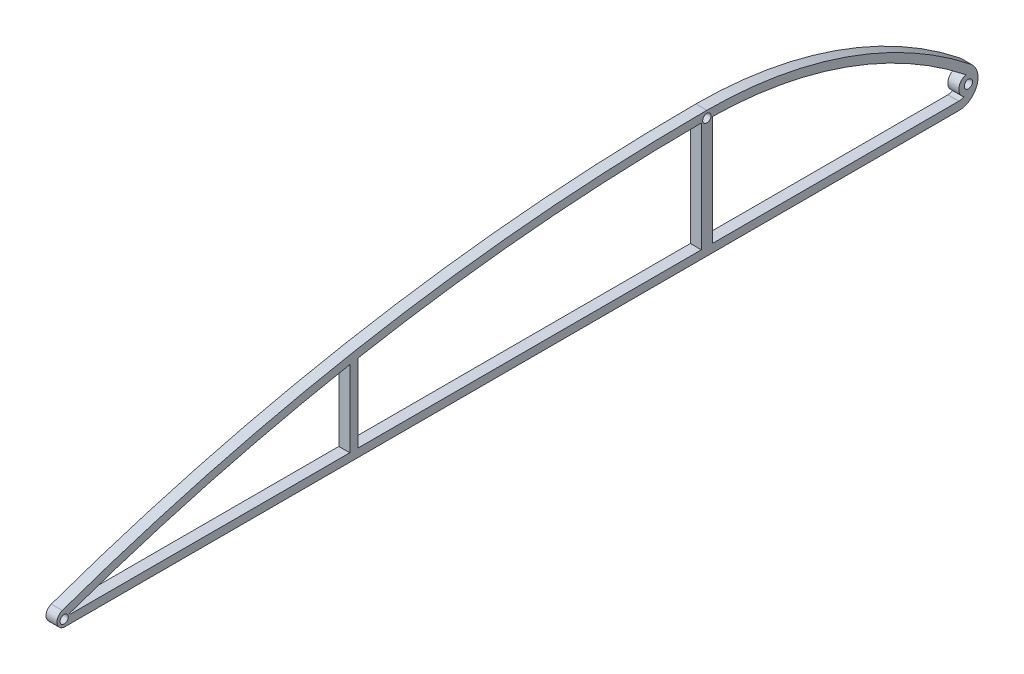
from build123d import *

# Parameters (mm, degrees)
BOSS_EXTRU_1_DEPTH      = 2
ESQUISSE4_R             = 0.75
ENL_V_MAT_EXTRU_2_DEPTH = 176.894862906
ENL_V_MAT_EXTRU_3_DEPTH = 4
CONG_2_R                = 1.45


with BuildPart() as part:
    # Esquisse2 → Boss.-Extru.1 (new body)
    with BuildSketch(Plane(origin=(0, 0, 0), x_dir=(0, 0, -1), z_dir=(1, 0, 0))):
        with BuildLine():
            Line((0, 0), (170.873171093, 0))
            ThreePointArc((170.873171093, 0), (174.177922559, 2.347343181), (173.049882129, 6.240789861))
            ThreePointArc((173.049882129, 6.240789861), (150.444362328, 18.689979585), (125, 23))
            ThreePointArc((125, 23), (61.450806457, 17.202138822), (0, 0))
        make_face()
    extrude(amount=BOSS_EXTRU_1_DEPTH)

    # Esquisse4 → Enlèv. mat.-Extru.2 (cut, through all)
    with BuildSketch(Plane(origin=(2, 0, 0), x_dir=(0, 0, -1), z_dir=(1, 0, 0))):
        with Locations((125, 21.75)):
            Circle(ESQUISSE4_R)
        with Locations((172.618958832, 3.328337296)):
            Circle(ESQUISSE4_R)
        with Locations((8, 1.25)):
            Circle(ESQUISSE4_R)
    extrude(amount=-ENL_V_MAT_EXTRU_2_DEPTH, mode=Mode.SUBTRACT)

    # Esquisse9 → Enlèv. mat.-Extru.3 (cut)
    with BuildSketch(Plane(origin=(0, 0, 0), x_dir=(0, 0, -1), z_dir=(1, 0, 0))):
        with BuildLine():
            Line((126, 1.5), (170.873171093, 1.5))
            ThreePointArc((170.873171093, 1.5), (171.378747106, 1.564956617), (171.851482612, 1.755607106))
            ThreePointArc((171.851482612, 1.755607106), (170.877358103, 3.499588293), (172.172511728, 5.020432147))
            ThreePointArc((172.172511728, 5.020432147), (172.144964437, 5.043548409), (172.11700597, 5.066165635))
            ThreePointArc((172.11700597, 5.066165635), (150.432293025, 17.103742315), (126.021977416, 21.493106696))
            ThreePointArc((126.021977416, 21.493106696), (126.011314857, 21.467285013), (126, 21.441742431))
            Line((126, 21.441742431), (126, 1.5))
        make_face()
        with BuildLine():
            Line((9.071214264, 1.5), (60, 1.5))
            Line((60, 1.5), (60, 15.405547145))
            ThreePointArc((60, 15.405547145), (34.242807282, 9.516740415), (9.003792697, 1.699889121))
            ThreePointArc((9.003792697, 1.699889121), (9.042306283, 1.601564521), (9.071214264, 1.5))
        make_face()
        with BuildLine():
            Line((124, 21.441742431), (124, 1.5))
            Line((124, 1.5), (61.5, 1.5))
            Line((61.5, 1.5), (61.5, 15.685935533))
            ThreePointArc((61.5, 15.685935533), (92.607306096, 19.996388454), (123.975891605, 21.498500317))
            ThreePointArc((123.975891605, 21.498500317), (123.987547995, 21.469952401), (124, 21.441742431))
        make_face()
    extrude(amount=ENL_V_MAT_EXTRU_3_DEPTH, mode=Mode.SUBTRACT)

    # Congé2
    cong_2_edges = [part.edges().sort_by_distance(p)[0] for p in [
        (1, 0, 0),
    ]]
    fillet(cong_2_edges, radius=CONG_2_R)


solid = part.part
